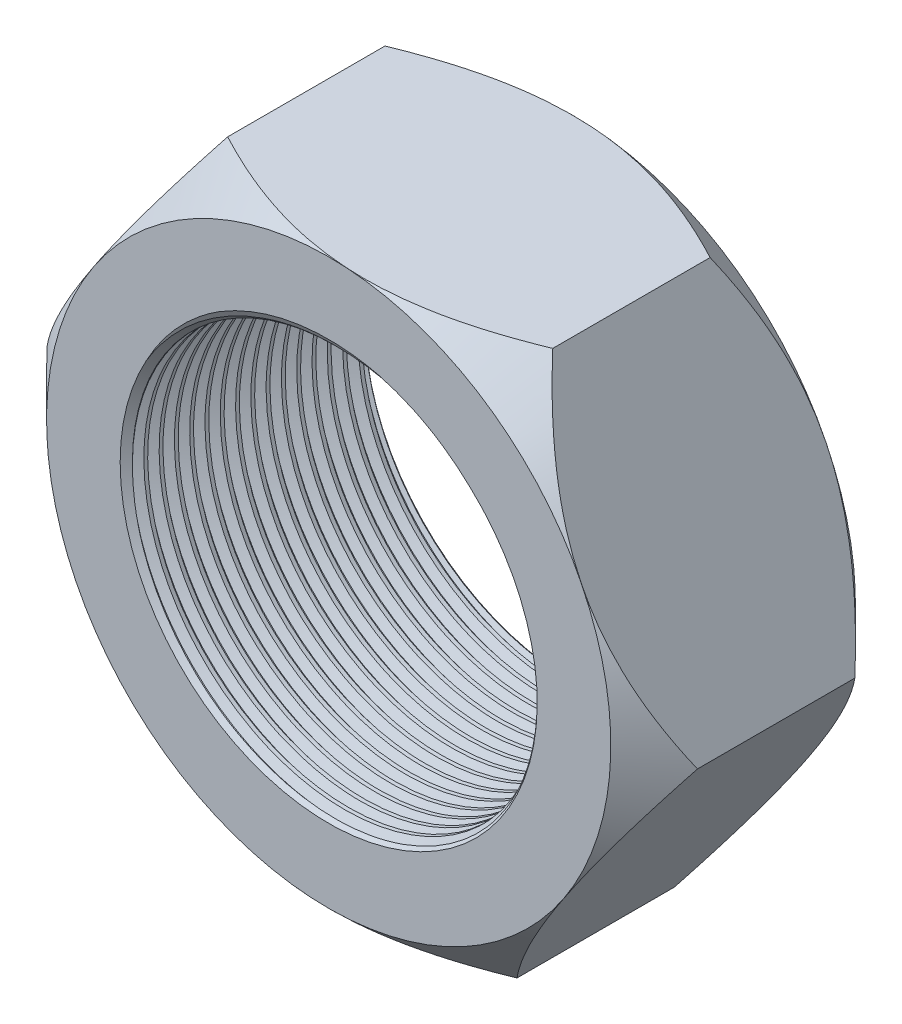
from build123d import *

# Parameters (mm, degrees)
BOSS_EXTRUDE1_DEPTH     = 20
SKETCH2_OUTSIDE_W       = 153.878
SKETCH2_OUTSIDE_H       = 148.442
SKETCH2_OUTSIDE_R       = 23.066276282
CUT_EXTRUDE6_DEPTH      = 41.939229322
CUT_EXTRUDE6_DRAFT      = -45
MIRROR3_COPY_1_SKETCH_W = 153.878
MIRROR3_COPY_1_SKETCH_H = 148.442
MIRROR3_COPY_1_SKETCH_R = 23.066276282
MIRROR3_COPY_1_DEPTH    = 41.939229322
MIRROR3_COPY_1_DRAFT    = -45
SKETCH9_R               = 16.54775635
CUT_EXTRUDE10_DEPTH     = 41.939229322
CHAMFER1_SIZE           = 0.5
THREAD1_PITCH           = 1.25


with BuildPart() as part:
    # Sketch1 → Boss-Extrude1 (new body)
    with BuildSketch(Plane.XY):
        Polygon((11.82971973, -23.863400145), (26.581170611, -1.686862267), (14.751450881, 22.176537878), (-11.82971973, 23.863400145), (-26.581170611, 1.686862267), (-14.751450881, -22.176537878), align=None)
    extrude(amount=BOSS_EXTRUDE1_DEPTH)


with BuildPart() as cut_extrude6_tool:
    # Sketch2 outside → Cut-Extrude6 (with draft: the straight prism first)
    with BuildSketch(Plane.XY.offset(20)):
        Rectangle(SKETCH2_OUTSIDE_W, SKETCH2_OUTSIDE_H)
        Circle(SKETCH2_OUTSIDE_R, mode=Mode.SUBTRACT)
    extrude(amount=-CUT_EXTRUDE6_DEPTH)
    # Cut-Extrude6: the draft: its side faces are tilted about the plane it starts from
    cut_extrude6_sides = [cut_extrude6_tool.faces().sort_by_distance(p)[0] for p in [
        (0, -74.221, -0.969614661),
        (76.939, 0, -0.969614661),
        (0, 74.221, -0.969614661),
        (-76.939, 0, -0.969614661),
        (-23.066276282, 0, -0.969614661),
    ]]
    draft(cut_extrude6_sides, Plane.XY.offset(20), CUT_EXTRUDE6_DRAFT)


with BuildPart() as part_1:
    add(part.part)

    # Cut-Extrude6: cut by cut_extrude6_tool
    add(cut_extrude6_tool.part, mode=Mode.SUBTRACT)


with BuildPart() as mirror3_copy_1_tool:
    # Mirror3 copy 1 sketch → Mirror3 copy 1 (with draft: the straight prism first)
    with BuildSketch(Plane(origin=(0, 0, 0), x_dir=(1, 0, 0), z_dir=(0, 0, -1))):
        Rectangle(MIRROR3_COPY_1_SKETCH_W, MIRROR3_COPY_1_SKETCH_H)
        Circle(MIRROR3_COPY_1_SKETCH_R, mode=Mode.SUBTRACT)
    extrude(amount=-MIRROR3_COPY_1_DEPTH)
    # Mirror3 copy 1: the draft: its side faces are tilted about the plane it starts from
    mirror3_copy_1_sides = [mirror3_copy_1_tool.faces().sort_by_distance(p)[0] for p in [
        (0, -74.221, 20.969614661),
        (76.939, 0, 20.969614661),
        (0, 74.221, 20.969614661),
        (-76.939, 0, 20.969614661),
        (-23.066276282, 0, 20.969614661),
    ]]
    draft(mirror3_copy_1_sides, Plane(origin=(0, 0, 0), x_dir=(1, 0, 0), z_dir=(0, 0, -1)), MIRROR3_COPY_1_DRAFT)


with BuildPart() as part_2:
    add(part_1.part)

    # Mirror3 copy 1: cut by mirror3_copy_1_tool
    add(mirror3_copy_1_tool.part, mode=Mode.SUBTRACT)

    # Sketch9 → Cut-Extrude10 (cut, through all)
    with BuildSketch(Plane.XY.offset(20)):
        Circle(SKETCH9_R)
    extrude(amount=-CUT_EXTRUDE10_DEPTH, mode=Mode.SUBTRACT)

    # Chamfer1
    chamfer1_edges = [part_2.edges().sort_by_distance(p)[0] for p in [
        (-16.54775635, 0, 0),
        (-16.54775635, 0, 20),
    ]]
    chamfer(chamfer1_edges, length=CHAMFER1_SIZE)

    # Thread1: the profile of Thread Profile2 profile screwed along a right-hand helix of 19.6 turns, 8 arcs to a turn; built about Z, then put on its axis
    thread1_z = Axis((0, 0, 0), (0, 0, 1))
    thread1_corners = [(16.54745635, 0, -0.000173205), (17.224338694, 0, 0.390624998), (17.224338694, 0, 0.546874998), (16.54745635, 0, 0.937673202)]
    with BuildLine(mode=Mode.PRIVATE) as thread1_profile:
        Line(thread1_corners[0], thread1_corners[1])
        Line(thread1_corners[1], thread1_corners[2])
        Line(thread1_corners[2], thread1_corners[3])
        Line(thread1_corners[3], thread1_corners[0])
    thread1_cap = Face(thread1_profile.wire())
    thread1_turn_angles = [0, 22.5, 45, 67.5, 90, 112.5, 135, 157.5, 180, 202.5, 225, 247.5, 270, 292.5, 315, 337.5, 360]
    thread1_turn_weights = [1, 0.9238795325112867, 1, 0.9238795325112867, 1, 0.9238795325112867, 1, 0.9238795325112867, 1, 0.9238795325112867, 1, 0.9238795325112867, 1, 0.9238795325112867, 1, 0.9238795325112867, 1]
    thread1_turn_rails = [Edge.make_bspline([Vector(p[0], p[1], 0).rotate(thread1_z, thread1_turn_angles[k]) / thread1_turn_weights[k] + Vector(0, 0, p[2] + THREAD1_PITCH * thread1_turn_angles[k] / 360) for k in range(17)], [0, 0, 0, 1, 1, 2, 2, 3, 3, 4, 4, 5, 5, 6, 6, 7, 7, 8, 8, 8], 2, thread1_turn_weights) for p in thread1_corners]
    thread1_turn_sides = [Face.make_surface_from_curves(thread1_turn_rails[p[0]], thread1_turn_rails[p[1]]) for p in [(0, 1), (1, 2), (2, 3), (3, 0)]]
    thread1_last_angles = [6840, 6862.5, 6885, 6907.5, 6930, 6952.5, 6975, 6997.5, 7020, 7038, 7056]
    thread1_last_weights = [1, 0.9238795325112867, 1, 0.9238795325112867, 1, 0.9238795325112867, 1, 0.9238795325112867, 1, 0.9510565162951486, 1]
    thread1_last_rails = [Edge.make_bspline([Vector(p[0], p[1], 0).rotate(thread1_z, thread1_last_angles[k]) / thread1_last_weights[k] + Vector(0, 0, p[2] + THREAD1_PITCH * thread1_last_angles[k] / 360) for k in range(11)], [0, 0, 0, 1, 1, 2, 2, 3, 3, 4, 4, 5, 5, 5], 2, thread1_last_weights) for p in thread1_corners]
    thread1_last_sides = [Face.make_surface_from_curves(thread1_last_rails[p[0]], thread1_last_rails[p[1]]) for p in [(0, 1), (1, 2), (2, 3), (3, 0)]]
    thread1 = Plane(origin=(0, 0, 24.5), x_dir=(-1, 0, 0), z_dir=(0, 0, -1)) * Solid(Shell([*[p.moved(Location((0, 0, THREAD1_PITCH * i))) for i in range(19) for p in thread1_turn_sides], *thread1_last_sides, thread1_cap, thread1_cap.rotate(thread1_z, 7056).moved(Location((0, 0, THREAD1_PITCH * 7056 / 360)))]))
    add(thread1, mode=Mode.SUBTRACT)


solid = part_2.part
